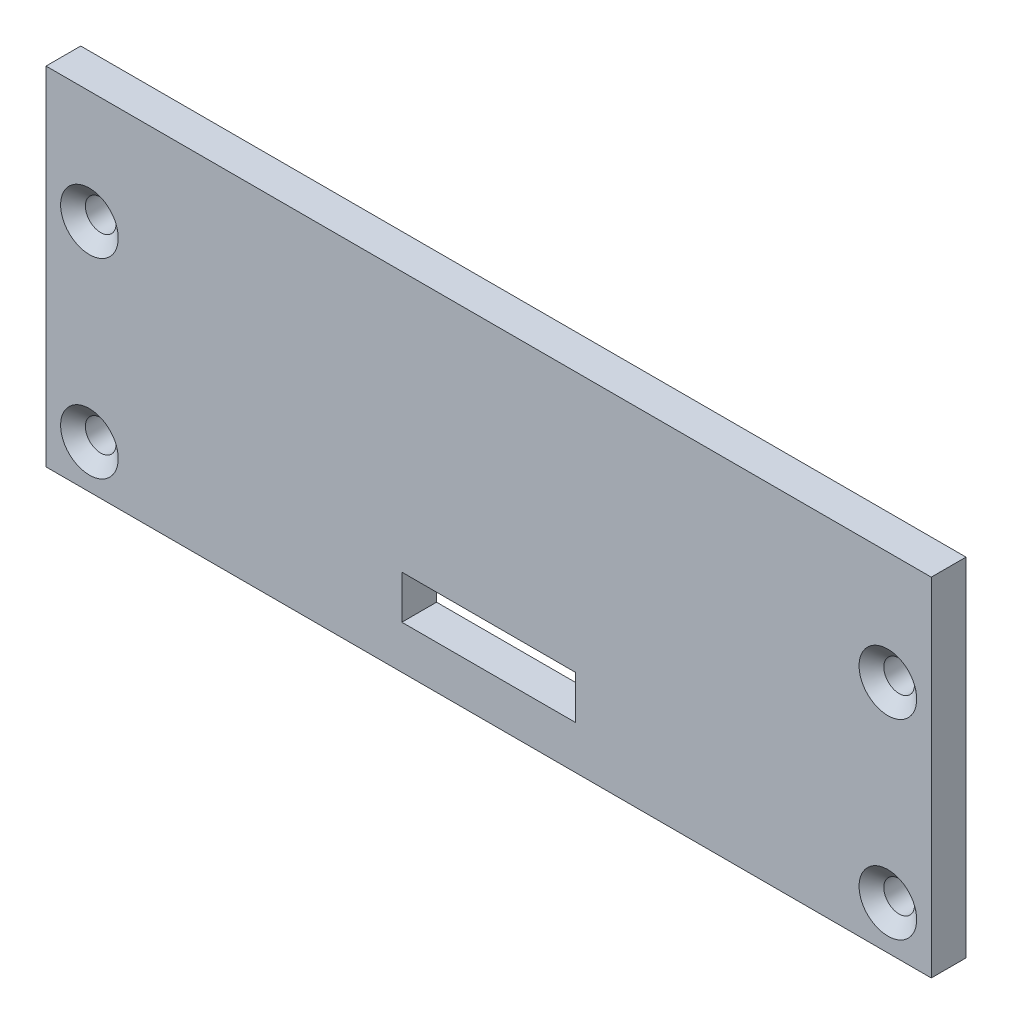
from build123d import *

# Parameters (mm, degrees)
SKETCH1_W                                         = 129.54
SKETCH1_H                                         = 50.8
BOSS_EXTRUDE1_DEPTH                               = 5.08
CSK_FOR_8_FLAT_HEAD_MACHINE_SCREW_100_D           = 4.4958
CSK_FOR_8_FLAT_HEAD_MACHINE_SCREW_100_CSINK_D     = 8.4328
CSK_FOR_8_FLAT_HEAD_MACHINE_SCREW_100_CSINK_ANGLE = 100
SKETCH5_W                                         = 25.4
SKETCH5_H                                         = 6.35
CUT_EXTRUDE1_DEPTH                                = 70.757575216


with BuildPart() as part:
    # Sketch1 → Boss-Extrude1 (new body)
    with BuildSketch(Plane.XY):
        Rectangle(SKETCH1_W, SKETCH1_H)
    extrude(amount=BOSS_EXTRUDE1_DEPTH)

    # CSK for #8 Flat Head Machine Screw (100)1 (through all)
    with Locations(Plane.XY.offset(5.08)):
        with Locations((-58.42, 8.89), (-58.42, -19.05), (58.42, -19.05), (58.42, 8.89)):
            CounterSinkHole(CSK_FOR_8_FLAT_HEAD_MACHINE_SCREW_100_D / 2, CSK_FOR_8_FLAT_HEAD_MACHINE_SCREW_100_CSINK_D / 2, counter_sink_angle=CSK_FOR_8_FLAT_HEAD_MACHINE_SCREW_100_CSINK_ANGLE)

    # Sketch5 → Cut-Extrude1 (cut, through all)
    with BuildSketch(Plane.XY.offset(5.08)):
        with Locations((0, -15.875)):
            Rectangle(SKETCH5_W, SKETCH5_H)
    extrude(amount=-CUT_EXTRUDE1_DEPTH, mode=Mode.SUBTRACT)


solid = part.part
